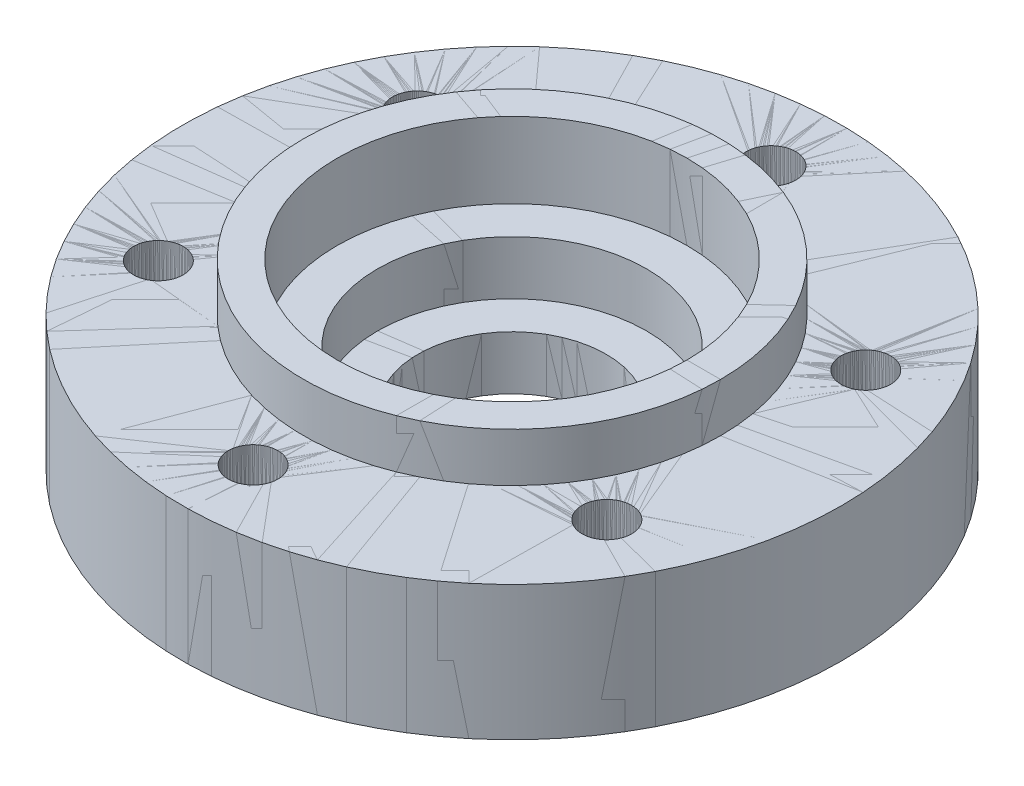
from build123d import *

# Parameters (mm, degrees)
REVOLVE_1_OUTLINE_R     = 49
REVOLVE_1_OUTLINE_R_2   = 26
REVOLVE_1_DEPTH         = 20
REVOLVE_1_2_OUTLINE_R   = 26
REVOLVE_1_2_OUTLINE_R_2 = 20
REVOLVE_1_2_DEPTH       = 16
REVOLVE_START           = 20
REVOLVE_1_3_OUTLINE_R   = 31
REVOLVE_1_3_OUTLINE_R_2 = 26
REVOLVE_1_3_DEPTH       = 7.25
REVOLVE_1_4_OUTLINE_R   = 20
REVOLVE_1_4_OUTLINE_R_2 = 14
REVOLVE_1_4_DEPTH       = 8
REVOLVE_1_5_OUTLINE_R   = 49
REVOLVE_1_5_OUTLINE_R_2 = 26
REVOLVE_1_5_DEPTH       = 20
REVOLVE_1_6_OUTLINE_R   = 26
REVOLVE_1_6_OUTLINE_R_2 = 20
REVOLVE_1_6_DEPTH       = 16
REVOLVE_1_7_OUTLINE_R   = 31
REVOLVE_1_7_OUTLINE_R_2 = 26
REVOLVE_1_7_DEPTH       = 7.25
REVOLVE_1_8_OUTLINE_R   = 20
REVOLVE_1_8_OUTLINE_R_2 = 14
REVOLVE_1_8_DEPTH       = 8
SKETCH_2_R              = 3.68
CUT_EXTRUDE_1_DEPTH     = 75.461819075
SKETCH_2_3_R            = 7
SKETCH_2_3_R_2          = 3.68
CUT_EXTRUDE_2_DEPTH     = 8


# Read off the part's stored shape, not the designer's step: 旋转1
with BuildPart() as part:
    # 旋转1 outline → 旋转1 (new body)
    with BuildSketch(Plane(origin=(0, 0, 0), x_dir=(1, 0, 0), z_dir=(0, 1, 0))):
        Circle(REVOLVE_1_OUTLINE_R)
        Circle(REVOLVE_1_OUTLINE_R_2, mode=Mode.SUBTRACT)
    extrude(amount=REVOLVE_1_DEPTH)

    # Revolve 1 2 outline → Revolve 1 2 (add)
    with BuildSketch(Plane(origin=(0, 0, 0), x_dir=(1, 0, 0), z_dir=(0, 1, 0))):
        Circle(REVOLVE_1_2_OUTLINE_R)
        Circle(REVOLVE_1_2_OUTLINE_R_2, mode=Mode.SUBTRACT)
    extrude(amount=REVOLVE_1_2_DEPTH)

    # Revolve 1 3 outline → Revolve 1 3 (add)
    with BuildSketch(Plane(origin=(0, 0, 0), x_dir=(1, 0, 0), z_dir=(0, 1, 0)).offset(REVOLVE_START)):
        Circle(REVOLVE_1_3_OUTLINE_R)
        Circle(REVOLVE_1_3_OUTLINE_R_2, mode=Mode.SUBTRACT)
    extrude(amount=REVOLVE_1_3_DEPTH)

    # Revolve 1 4 outline → Revolve 1 4 (add)
    with BuildSketch(Plane(origin=(0, 0, 0), x_dir=(1, 0, 0), z_dir=(0, 1, 0))):
        Circle(REVOLVE_1_4_OUTLINE_R)
        Circle(REVOLVE_1_4_OUTLINE_R_2, mode=Mode.SUBTRACT)
    extrude(amount=REVOLVE_1_4_DEPTH)


with BuildPart() as body_2:
    # Revolve 1 5 outline → Revolve 1 5 (new body)
    with BuildSketch(Plane(origin=(0, 0, 0), x_dir=(1, 0, 0), z_dir=(0, 1, 0))):
        Circle(REVOLVE_1_5_OUTLINE_R)
        Circle(REVOLVE_1_5_OUTLINE_R_2, mode=Mode.SUBTRACT)
    extrude(amount=REVOLVE_1_5_DEPTH)

    # Revolve 1 6 outline → Revolve 1 6 (add)
    with BuildSketch(Plane(origin=(0, 0, 0), x_dir=(1, 0, 0), z_dir=(0, 1, 0))):
        Circle(REVOLVE_1_6_OUTLINE_R)
        Circle(REVOLVE_1_6_OUTLINE_R_2, mode=Mode.SUBTRACT)
    extrude(amount=REVOLVE_1_6_DEPTH)

    # Revolve 1 7 outline → Revolve 1 7 (add)
    with BuildSketch(Plane(origin=(0, 0, 0), x_dir=(1, 0, 0), z_dir=(0, 1, 0)).offset(REVOLVE_START)):
        Circle(REVOLVE_1_7_OUTLINE_R)
        Circle(REVOLVE_1_7_OUTLINE_R_2, mode=Mode.SUBTRACT)
    extrude(amount=REVOLVE_1_7_DEPTH)

    # Revolve 1 8 outline → Revolve 1 8 (add)
    with BuildSketch(Plane(origin=(0, 0, 0), x_dir=(1, 0, 0), z_dir=(0, 1, 0))):
        Circle(REVOLVE_1_8_OUTLINE_R)
        Circle(REVOLVE_1_8_OUTLINE_R_2, mode=Mode.SUBTRACT)
    extrude(amount=REVOLVE_1_8_DEPTH)


with BuildPart() as cut_extrude_1_tool:
    # 草图2 → 切除-拉伸1 (new, through all)
    with BuildSketch(Plane.XZ):
        with Locations((0, 38.5)):
            Circle(SKETCH_2_R)
        with Locations((33.341978046, 19.25)):
            Circle(SKETCH_2_R)
        with Locations((33.341978046, -19.25)):
            Circle(SKETCH_2_R)
        with Locations((0, -38.5)):
            Circle(SKETCH_2_R)
        with Locations((-33.341978046, -19.25)):
            Circle(SKETCH_2_R)
        with Locations((-33.341978046, 19.25)):
            Circle(SKETCH_2_R)
    extrude(amount=-CUT_EXTRUDE_1_DEPTH)


with BuildPart() as part_1:
    add(part.part)

    # 切除-拉伸1: cut by cut_extrude_1_tool
    add(cut_extrude_1_tool.part, mode=Mode.SUBTRACT)


with BuildPart() as body_2_1:
    add(body_2.part)

    # 切除-拉伸1: cut by cut_extrude_1_tool
    add(cut_extrude_1_tool.part, mode=Mode.SUBTRACT)


with BuildPart() as cut_extrude_2_tool:
    # 草图2<3> → 切除-拉伸2 (new body)
    # profile 1 of 6: a face of its own
    with BuildSketch(Plane.XZ):
        with Locations((0, 38.5)):
            Circle(SKETCH_2_3_R)
        with Locations((0, 38.5)):
            Circle(SKETCH_2_3_R_2, mode=Mode.SUBTRACT)
    # profile 2 of 6: a face of its own
    with BuildSketch(Plane.XZ):
        with Locations((33.341978046, 19.25)):
            Circle(SKETCH_2_3_R)
        with Locations((33.341978046, 19.25)):
            Circle(SKETCH_2_3_R_2, mode=Mode.SUBTRACT)
    # profile 3 of 6: a face of its own
    with BuildSketch(Plane.XZ):
        with Locations((33.341978046, -19.25)):
            Circle(SKETCH_2_3_R)
        with Locations((33.341978046, -19.25)):
            Circle(SKETCH_2_3_R_2, mode=Mode.SUBTRACT)
    # profile 4 of 6: a face of its own
    with BuildSketch(Plane.XZ):
        with Locations((0, -38.5)):
            Circle(SKETCH_2_3_R)
        with Locations((0, -38.5)):
            Circle(SKETCH_2_3_R_2, mode=Mode.SUBTRACT)
    # profile 5 of 6: a face of its own
    with BuildSketch(Plane.XZ):
        with Locations((-33.341978046, -19.25)):
            Circle(SKETCH_2_3_R)
        with Locations((-33.341978046, -19.25)):
            Circle(SKETCH_2_3_R_2, mode=Mode.SUBTRACT)
    # profile 6 of 6: a face of its own
    with BuildSketch(Plane.XZ):
        with Locations((-33.341978046, 19.25)):
            Circle(SKETCH_2_3_R)
        with Locations((-33.341978046, 19.25)):
            Circle(SKETCH_2_3_R_2, mode=Mode.SUBTRACT)
    extrude(amount=-CUT_EXTRUDE_2_DEPTH)


with BuildPart() as part_2:
    add(part_1.part)

    # 切除-拉伸2: cut by cut_extrude_2_tool
    add(cut_extrude_2_tool.part, mode=Mode.SUBTRACT)


with BuildPart() as body_2_2:
    add(body_2_1.part)

    # 切除-拉伸2: cut by cut_extrude_2_tool
    add(cut_extrude_2_tool.part, mode=Mode.SUBTRACT)


solid = Compound([part_2.part, body_2_2.part])
